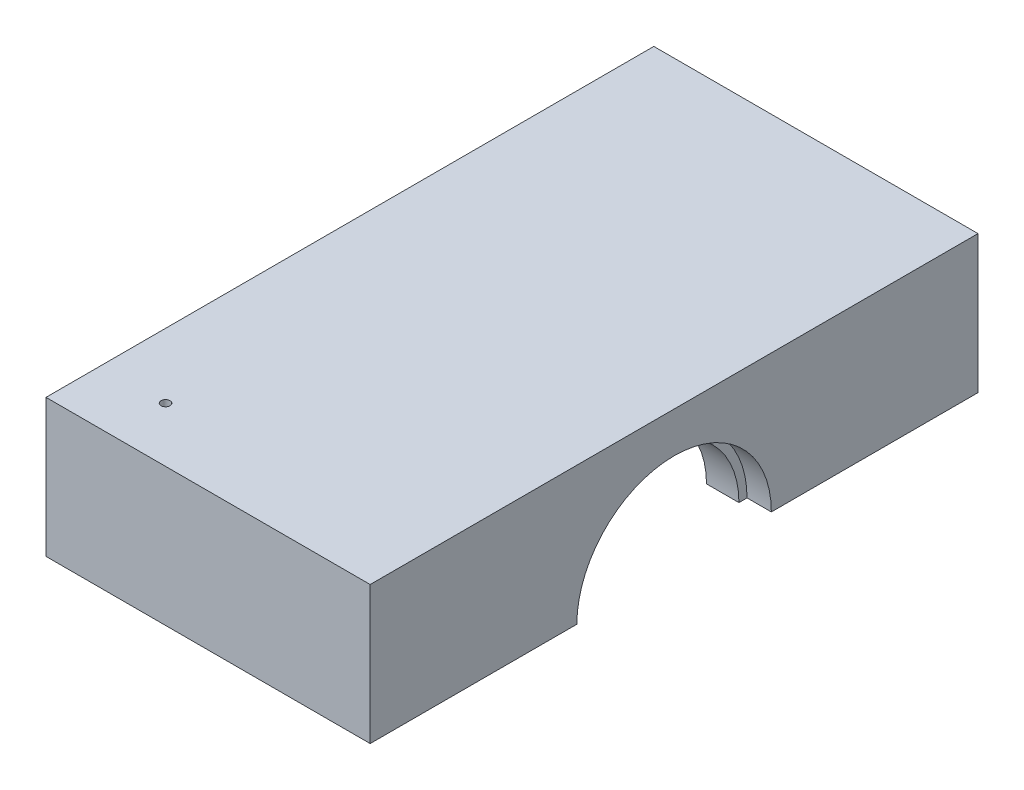
from build123d import *
from build123d.topology import SkipClean

# Parameters (mm, degrees)
EXTRUDE_2_DEPTH      = 40
EXTRUDE_2_DEPTH_BACK = 40
SKETCH_1_W           = 150
SKETCH_1_H           = 10
EXTRUDE_3_DEPTH      = 14
EXTRUDE_4_DEPTH      = 14
SKETCH_4_W           = 2
SKETCH_4_H           = 52
EXTRUDE_5_DEPTH      = 24
SKETCH_5_R           = 22
CUT_EXTRUDE_1_DEPTH  = 81
CUT_EXTRUDE_6_DEPTH  = 8
SKETCH_7_W           = 69
SKETCH_7_H           = 55
SKETCH_7_W_2         = 65.5
SKETCH_7_H_2         = 52
EXTRUDE_6_DEPTH      = 4
SKETCH_12_W          = 66
SKETCH_12_H          = 1.5
EXTRUDE_8_DEPTH      = 5
CUT_EXTRUDE_7_DEPTH  = 6
CUT_EXTRUDE_START    = -6
CUT_EXTRUDE_8_DEPTH  = 6
SKETCH_15_R          = 1.1
CUT_EXTRUDE_9_DEPTH  = 4
SKETCH_16_W          = 15.246183725
SKETCH_16_H          = 18.547486822
CUT_EXTRUDE_10_DEPTH = 2
SKETCH_17_W          = 13.790442518
SKETCH_17_H          = 12.65745234
CUT_EXTRUDE_11_DEPTH = 8
EXTRUDE_9_DEPTH      = 24


with BuildPart() as part:
    # Эскиз1 → Бобышка-Вытянуть2 (new, two sides: drawn at the far end of the back side and taken through both)
    with BuildSketch(Plane(origin=(0, 0, 0), x_dir=(0, 0, -1), z_dir=(1, 0, 0)).offset(-EXTRUDE_2_DEPTH_BACK)):
        with Locations((0, 29)):
            Rectangle(SKETCH_1_W, SKETCH_1_H)
    extrude(amount=EXTRUDE_2_DEPTH + EXTRUDE_2_DEPTH_BACK)

    # Эскиз3 → Бобышка-Вытянуть4 (add)
    with BuildSketch(Plane.ZY.offset(40)):
        with BuildLine():
            Line((-26, 0), (-22, 0))
            ThreePointArc((-22, 0), (0, 22), (22, 0))
            Line((22, 0), (26, 0))
            ThreePointArc((26, 0), (0, 26), (-26, 0))
        make_face()
    extrude(amount=-EXTRUDE_4_DEPTH)



with BuildPart() as body_2:
    # Эскиз2 → Бобышка-Вытянуть3 (new body)
    with BuildSketch(Plane(origin=(40, 0, 0), x_dir=(0, 0, -1), z_dir=(1, 0, 0))):
        with BuildLine():
            Line((-26, 0), (-22, 0))
            ThreePointArc((-22, 0), (0, 22), (22, 0))
            Line((22, 0), (26, 0))
            ThreePointArc((26, 0), (0, 26), (-26, 0))
        make_face()
    extrude(amount=-EXTRUDE_3_DEPTH)


with BuildPart() as part_1:
    add(part.part)

    add(body_2.part)  # Бобышка-Вытянуть5 merges body 2
    # Эскиз4 → Бобышка-Вытянуть5 (add)
    with BuildSketch(Plane(origin=(0, 24, 0), x_dir=(-1, 0, 0), z_dir=(0, -1, 0))):
        with Locations((39, 0)):
            Rectangle(SKETCH_4_W, SKETCH_4_H)
        with Locations((-39, 0)):
            Rectangle(SKETCH_4_W, SKETCH_4_H)
    extrude(amount=EXTRUDE_5_DEPTH)

    # Эскиз5 → Вырез-Вытянуть1 (cut)
    with SkipClean():  # the faces are left unmerged after this step: merging them gives an invalid solid
        with BuildSketch(Plane(origin=(40, 0, 0), x_dir=(0, 0, -1), z_dir=(1, 0, 0))):
            Circle(SKETCH_5_R)
        extrude(amount=-CUT_EXTRUDE_1_DEPTH, mode=Mode.SUBTRACT)
    add(part_1.part.scale(1), mode=Mode.REPLACE)  # the faces are merged on a copy

    # Эскиз6 → Вырез-Вытянуть6 (cut)
    with BuildSketch(Plane(origin=(0, 24, 0), x_dir=(-1, 0, 0), z_dir=(0, -1, 0))):
        Polygon((38, 28), (36, 28), (36, 13), (24, 13), (24, -13), (36, -13), (36, -28), (38, -28), (38, -73), (-38, -73), (-38, -27.999124699), (-36, -27.999124699), (-36, -13), (-24, -13), (-24, 13), (-36, 13), (-36, 28), (-38, 28), (-38, 73), (38, 73), align=None)
    extrude(amount=-CUT_EXTRUDE_6_DEPTH, mode=Mode.SUBTRACT)

    # Эскиз7 → Бобышка-Вытянуть6 (add)
    with BuildSketch(Plane.XZ.offset(-32)):
        with Locations((5.5, 39)):
            Rectangle(SKETCH_7_W, SKETCH_7_H)
        with Locations((5.25, 39)):
            Rectangle(SKETCH_7_W_2, SKETCH_7_H_2, mode=Mode.SUBTRACT)
    extrude(amount=EXTRUDE_6_DEPTH)

    # Эскиз12 → Бобышка-Вытянуть8 (add)
    with BuildSketch(Plane.XY.offset(13)):
        with Locations((5, 28.788266855)):
            Rectangle(SKETCH_12_W, SKETCH_12_H)
    extrude(amount=EXTRUDE_8_DEPTH)

    # Эскиз13 → Вырез-Вытянуть7 (cut)
    with BuildSketch(Plane(origin=(40, 0, 0), x_dir=(0, 0, -1), z_dir=(1, 0, 0))):
        with BuildLine():
            Line((-24, 0), (-22, 0))
            ThreePointArc((-22, 0), (0, 22), (22, 0))
            Line((22, 0), (24, 0))
            ThreePointArc((24, 0), (0, 24), (-24, 0))
        make_face()
    extrude(amount=-CUT_EXTRUDE_7_DEPTH, mode=Mode.SUBTRACT)

    # Эскиз14 → Вырез-Вытянуть8 (cut)
    with BuildSketch(Plane.ZY.offset(40).offset(CUT_EXTRUDE_START)):
        with BuildLine():
            Line((-24, 0), (-22, 0))
            ThreePointArc((-22, 0), (0, 22), (22, 0))
            Line((22, 0), (24, 0))
            ThreePointArc((24, 0), (0, 24), (-24, 0))
        make_face()
    extrude(amount=CUT_EXTRUDE_8_DEPTH, mode=Mode.SUBTRACT)

    # Эскиз15 → Вырез-Вытянуть9 (cut)
    with BuildSketch(Plane.XZ.offset(-32)):
        with Locations((-24, 61.5)):
            Circle(SKETCH_15_R)
    extrude(amount=-CUT_EXTRUDE_9_DEPTH, mode=Mode.SUBTRACT)

    # Эскиз16 → Вырез-Вытянуть10 (cut)
    with BuildSketch(Plane.XZ.offset(-32)):
        with Locations((30.376908138, 22.273743411)):
            Rectangle(SKETCH_16_W, SKETCH_16_H)
    extrude(amount=CUT_EXTRUDE_10_DEPTH, mode=Mode.SUBTRACT)

    # Эскиз17 → Вырез-Вытянуть11 (cut)
    with BuildSketch(Plane.XZ.offset(-24)):
        with Locations((31.104778741, 24.32872617)):
            Rectangle(SKETCH_17_W, SKETCH_17_H)
    extrude(amount=-CUT_EXTRUDE_11_DEPTH, mode=Mode.SUBTRACT)

    # Эскиз18 → Бобышка-Вытянуть9 (add)
    with BuildSketch(Plane.XZ.offset(-24)):
        Polygon((-40, -24), (-38, -24), (-38, -26), (-38, -73), (38, -73), (38, -26), (38, -24), (40, -24), (40, -75), (-40, -75), align=None)
        Polygon((-40, 75), (40, 75), (40, 26), (40, 24), (38, 24), (38, 26), (38, 73), (-38, 73), (-38, 26), (-38, 24), (-40, 24), (-40, 26), align=None)
    extrude(amount=EXTRUDE_9_DEPTH)


solid = part_1.part
